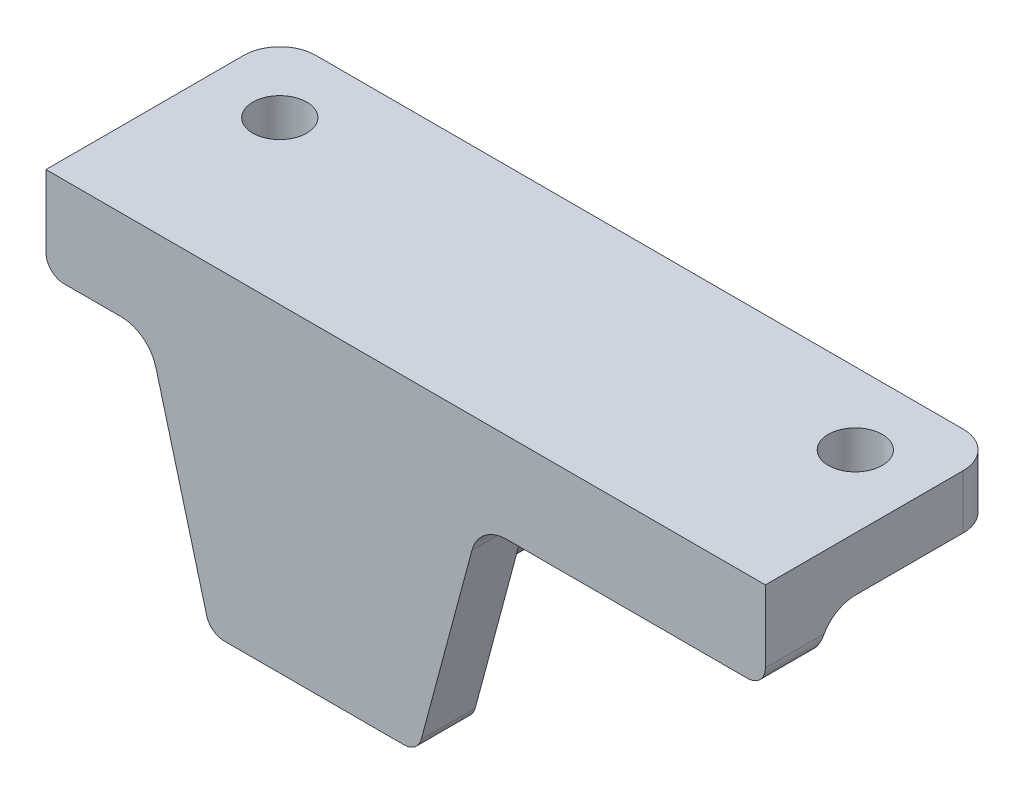
from build123d import *

# Parameters (mm, degrees)
BOSS_EXTRUDE1_DEPTH = 3
SKETCH4_W           = 40
SKETCH4_H           = 3
BOSS_EXTRUDE2_DEPTH = 10
FILLET1_R           = 2
FILLET2_R           = 2
SKETCH5_R           = 1.5
CUT_EXTRUDE1_DEPTH  = 27.787357167
SKETCH6_R           = 3.5
BOSS_EXTRUDE3_DEPTH = 16
FILLET3_R           = 0.5
SKETCH7_W           = 10
SKETCH7_H           = 8.75
BOSS_EXTRUDE4_DEPTH = 1.5
FILLET4_R           = 1


with BuildPart() as part:
    # Sketch3 → Boss-Extrude1 (new body)
    with BuildSketch(Plane.XY):
        with BuildLine():
            Line((-0.1, -6), (-10.1, -6))
            ThreePointArc((-10.1, -6), (-10.708761429, -5.79335334), (-11.065925826, -5.258819045))
            Line((-11.065925826, -5.258819045), (-13.886481515, 5.26763809))
            ThreePointArc((-13.886481515, 5.26763809), (-14.600810309, 6.336706681), (-15.818333167, 6.75))
            Line((-15.818333167, 6.75), (-19, 6.75))
            ThreePointArc((-19, 6.75), (-19.707106781, 7.042893219), (-20, 7.75))
            Line((-20, 7.75), (-20, 11.75))
            Line((-20, 11.75), (20, 11.75))
            Line((20, 11.75), (20, 7.75))
            ThreePointArc((20, 7.75), (19.707106781, 7.042893219), (19, 6.75))
            Line((19, 6.75), (5.618333167, 6.75))
            ThreePointArc((5.618333167, 6.75), (4.400810309, 6.336706681), (3.686481515, 5.26763809))
            Line((3.686481515, 5.26763809), (0.865925826, -5.258819045))
            ThreePointArc((0.865925826, -5.258819045), (0.508761429, -5.79335334), (-0.1, -6))
        make_face()
    extrude(amount=BOSS_EXTRUDE1_DEPTH)

    # Sketch4 → Boss-Extrude2 (add)
    with BuildSketch(Plane(origin=(0, 0, 0), x_dir=(-1, 0, 0), z_dir=(0, 0, -1))):
        with Locations((0, 10.25)):
            Rectangle(SKETCH4_W, SKETCH4_H)
    extrude(amount=BOSS_EXTRUDE2_DEPTH)

    # Fillet1
    fillet1_edges = [part.edges().sort_by_distance(p)[0] for p in [
        (0, 8.75, 0),
    ]]
    fillet(fillet1_edges, radius=FILLET1_R - 0.0001)  # a hair under: the kernel refuses the full size

    # Fillet2
    fillet2_edges = [part.edges().sort_by_distance(p)[0] for p in [
        (20, 10.25, -10),
        (-20, 10.25, -10),
    ]]
    fillet(fillet2_edges, radius=FILLET2_R)

    # Sketch5 → Cut-Extrude1 (cut, through all)
    with BuildSketch(Plane.XZ.offset(-8.75)):
        with Locations(Location((-16, -6, 0), (0, 0, 270))):
            Circle(SKETCH5_R)
    cut_extrude1 = extrude(amount=-CUT_EXTRUDE1_DEPTH, mode=Mode.SUBTRACT)

    # Mirror1: Cut-Extrude1 across plane
    add(cut_extrude1.mirror(Plane(origin=(0, 0, 0), x_dir=(0, 0, 1), z_dir=(1, 0, 0))), mode=Mode.SUBTRACT)

    # Sketch6 → Boss-Extrude3 (add)
    with BuildSketch(Plane(origin=(0, 0, 0), x_dir=(-1, 0, 0), z_dir=(0, 0, -1))):
        with Locations((5.1, 0)):
            Circle(SKETCH6_R)
    extrude(amount=BOSS_EXTRUDE3_DEPTH)

    # Fillet3
    fillet3_edges = [part.edges().sort_by_distance(p)[0] for p in [
        (-1.6, 0, -16),
    ]]
    fillet(fillet3_edges, radius=FILLET3_R)

    # Sketch7 → Boss-Extrude4 (add, symmetric)
    with BuildSketch(Plane(origin=(-5.1, 0, 0), x_dir=(0, 0, -1), z_dir=(1, 0, 0))):
        with Locations((5, 4.375)):
            Rectangle(SKETCH7_W, SKETCH7_H)
    extrude(amount=BOSS_EXTRUDE4_DEPTH, both=True)

    # Fillet4
    fillet4_edges = [part.edges().sort_by_distance(p)[0] for p in [
        (-3.6, 8.164242852, -0.585757148),
        (-6.6, 4.95618883, 0),
        (-6.6, 8.164242852, -0.585757148),
        (-6.6, 8.75, -5.99995),
        (-3.6, 8.75, -5.99995),
        (-3.6, 4.95618883, 0),
        (-6.6, 3.16227766, -5),
        (-5.1, 3.5, -10),
        (-3.6, 3.16227766, -5),
    ]]
    fillet(fillet4_edges, radius=FILLET4_R)


solid = part.part
